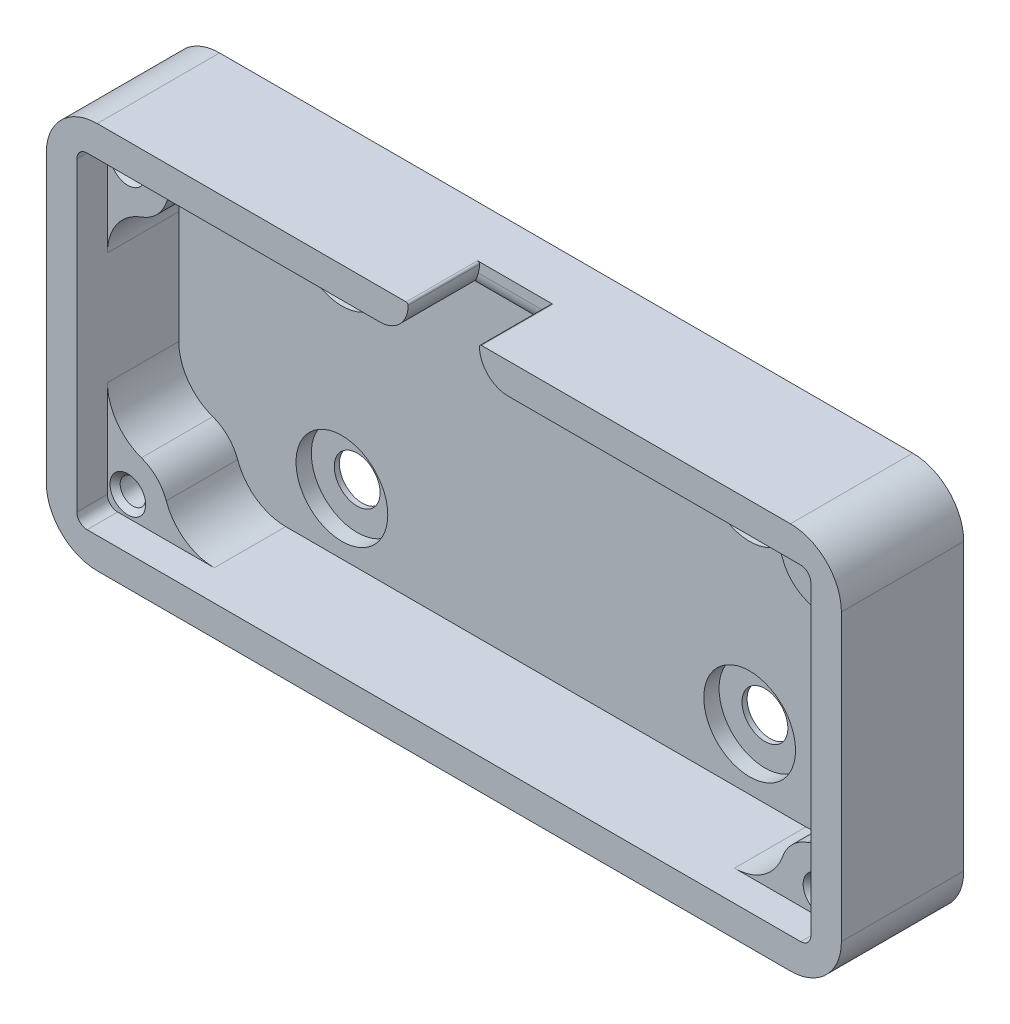
from build123d import *

# Parameters (mm, degrees)
SCHIZZO1_W                   = 78
SCHIZZO1_H                   = 38
SCHIZZO1_R                   = 2.25
ESTRUSIONE_ESTRUSIONE1_DEPTH = 2
SCHIZZO2_W                   = 78
SCHIZZO2_H                   = 38
SCHIZZO2_R                   = 1.25
ESTRUSIONE_ESTRUSIONE2_DEPTH = 7
SCHIZZO3_W                   = 78
SCHIZZO3_H                   = 38
SCHIZZO3_W_2                 = 72
SCHIZZO3_H_2                 = 32
ESTRUSIONE_ESTRUSIONE3_DEPTH = 3
SMUSSO1_SIZE                 = 0.5
RACCORDO1_R                  = 5
SCHIZZO4_R                   = 4.5
TAGLIO_ESTRUSIONE1_DEPTH     = 1.5
RACCORDO2_R                  = 5
RACCORDO3_R                  = 1
TAGLIO_ESTRUSIONE2_REACH     = 57.758
SCHIZZO5_W                   = 7
SCHIZZO5_H                   = 7
RACCORDO4_R                  = 2.8
RACCORDO5_R                  = 0.2
RACCORDO6_R                  = 2


with BuildPart() as part:
    # Schizzo1 → Estrusione-Estrusione1 (new body)
    with BuildSketch(Plane.XY):
        Rectangle(SCHIZZO1_W, SCHIZZO1_H)
        with BuildLine():
            ThreePointArc((-34, 12.75), (-34.883883476, 14.883883476), (-32.75, 14))
            Line((-32.75, 14), (-34, 14))
            Line((-34, 14), (-34, 12.75))
        make_face(mode=Mode.SUBTRACT)
        with BuildLine():
            ThreePointArc((32.75, 14), (34.883883476, 14.883883476), (34, 12.75))
            Line((34, 12.75), (34, 14))
            Line((34, 14), (32.75, 14))
        make_face(mode=Mode.SUBTRACT)
        with BuildLine():
            ThreePointArc((34, -12.75), (34.883883476, -14.883883476), (32.75, -14))
            Line((32.75, -14), (34, -14))
            Line((34, -14), (34, -12.75))
        make_face(mode=Mode.SUBTRACT)
        with BuildLine():
            ThreePointArc((-32.75, -14), (-34.883883476, -14.883883476), (-34, -12.75))
            Line((-34, -12.75), (-34, -14))
            Line((-34, -14), (-32.75, -14))
        make_face(mode=Mode.SUBTRACT)
        with Locations((20, 10)):
            Circle(SCHIZZO1_R, mode=Mode.SUBTRACT)
        with Locations((-20, 10)):
            Circle(SCHIZZO1_R, mode=Mode.SUBTRACT)
        with Locations((20, -10)):
            Circle(SCHIZZO1_R, mode=Mode.SUBTRACT)
        with Locations((-20, -10)):
            Circle(SCHIZZO1_R, mode=Mode.SUBTRACT)
    extrude(amount=ESTRUSIONE_ESTRUSIONE1_DEPTH)

    # Schizzo2 → Estrusione-Estrusione2 (add)
    with BuildSketch(Plane.XY.offset(2)):
        Rectangle(SCHIZZO2_W, SCHIZZO2_H)
        with BuildLine():
            ThreePointArc((-36, 10.535898385), (-31.171572875, 11.171572875), (-30.535898385, 16))
            Line((-30.535898385, 16), (30.535898385, 16))
            ThreePointArc((30.535898385, 16), (31.171572875, 11.171572875), (36, 10.535898385))
            Line((36, 10.535898385), (36, -10.535898385))
            ThreePointArc((36, -10.535898385), (31.171572875, -11.171572875), (30.535898385, -16))
            Line((30.535898385, -16), (-30.535898385, -16))
            ThreePointArc((-30.535898385, -16), (-31.171572875, -11.171572875), (-36, -10.535898385))
            Line((-36, -10.535898385), (-36, 10.535898385))
        make_face(mode=Mode.SUBTRACT)
        with Locations((-34, 14)):
            Circle(SCHIZZO2_R, mode=Mode.SUBTRACT)
        with Locations((-34, -14)):
            Circle(SCHIZZO2_R, mode=Mode.SUBTRACT)
        with Locations(Location((34, -14, 0), (0, 0, 180))):
            Circle(SCHIZZO2_R, mode=Mode.SUBTRACT)
        with Locations(Location((34, 14, 0), (0, 0, 180))):
            Circle(SCHIZZO2_R, mode=Mode.SUBTRACT)
    extrude(amount=ESTRUSIONE_ESTRUSIONE2_DEPTH)

    # Schizzo3 → Estrusione-Estrusione3 (add)
    with BuildSketch(Plane.XY.offset(9)):
        Rectangle(SCHIZZO3_W, SCHIZZO3_H)
        Rectangle(SCHIZZO3_W_2, SCHIZZO3_H_2, mode=Mode.SUBTRACT)
    extrude(amount=ESTRUSIONE_ESTRUSIONE3_DEPTH)

    # Smusso1
    smusso1_edges = [part.edges().sort_by_distance(p)[0] for p in [
        (35.25, -14, 9),
        (-35.25, -14, 9),
        (-35.25, 14, 9),
        (35.25, 14, 9),
    ]]
    chamfer(smusso1_edges, length=SMUSSO1_SIZE)

    # Raccordo1
    raccordo1_edges = [part.edges().sort_by_distance(p)[0] for p in [
        (39, 19, 6),
        (39, -19, 6),
        (-39, -19, 6),
        (-39, 19, 6),
    ]]
    fillet(raccordo1_edges, radius=RACCORDO1_R)

    # Schizzo4 → Taglio-Estrusione1 (cut)
    with BuildSketch(Plane.XY.offset(2)):
        with Locations((-20, 10)):
            Circle(SCHIZZO4_R)
        with Locations((20, 10)):
            Circle(SCHIZZO4_R)
        with Locations((20, -10)):
            Circle(SCHIZZO4_R)
        with Locations((-20, -10)):
            Circle(SCHIZZO4_R)
    extrude(amount=-TAGLIO_ESTRUSIONE1_DEPTH, mode=Mode.SUBTRACT)

    # Raccordo2
    raccordo2_edges = [part.edges().sort_by_distance(p)[0] for p in [
        (30.535898385, 16, 5.5),
        (36, 10.535898385, 5.5),
        (36, -10.535898385, 5.5),
        (30.535898385, -16, 5.5),
        (-30.535898385, -16, 5.5),
        (-36, -10.535898385, 5.5),
        (-36, 10.535898385, 5.5),
        (-30.535898385, 16, 5.5),
    ]]
    fillet(raccordo2_edges, radius=RACCORDO2_R)

    # Raccordo3
    raccordo3_edges = [part.edges().sort_by_distance(p)[0] for p in [
        (-36, 16, 10.5),
        (-36, -16, 10.5),
        (36, -16, 10.5),
        (36, 16, 10.5),
    ]]
    fillet(raccordo3_edges, radius=RACCORDO3_R)

    # Schizzo5 → Taglio-Estrusione2 (cut, up to next)
    with BuildSketch(Plane(origin=(0, 19, 0), x_dir=(1, 0, 0), z_dir=(0, 1, 0)), mode=Mode.PRIVATE) as taglio_estrusione2_sk1:
        with Locations((0, -8.5)):
            Rectangle(SCHIZZO5_W, SCHIZZO5_H)
    taglio_estrusione2_tool1 = extrude(taglio_estrusione2_sk1.sketch, amount=-TAGLIO_ESTRUSIONE2_REACH, mode=Mode.PRIVATE) & part.part
    add(taglio_estrusione2_tool1.solids().sort_by_distance((0, 19, 8.5))[0], mode=Mode.SUBTRACT)

    # Raccordo4
    raccordo4_edges = [part.edges().sort_by_distance(p)[0] for p in [
        (3.5, 16, 8.5),
        (-3.5, 16, 8.5),
    ]]
    fillet(raccordo4_edges, radius=RACCORDO4_R)

    # Raccordo5
    raccordo5_edges = [part.edges().sort_by_distance(p)[0] for p in [
        (-3.5, 19, 8.5),
        (3.5, 19, 8.5),
    ]]
    fillet(raccordo5_edges, radius=RACCORDO5_R - 0.0001)  # a hair under: the kernel refuses the full size

    # Raccordo6
    raccordo6_edges = [part.edges().sort_by_distance(p)[0] for p in [
        (0, 16, 5),
    ]]
    fillet(raccordo6_edges, radius=RACCORDO6_R)


solid = part.part
